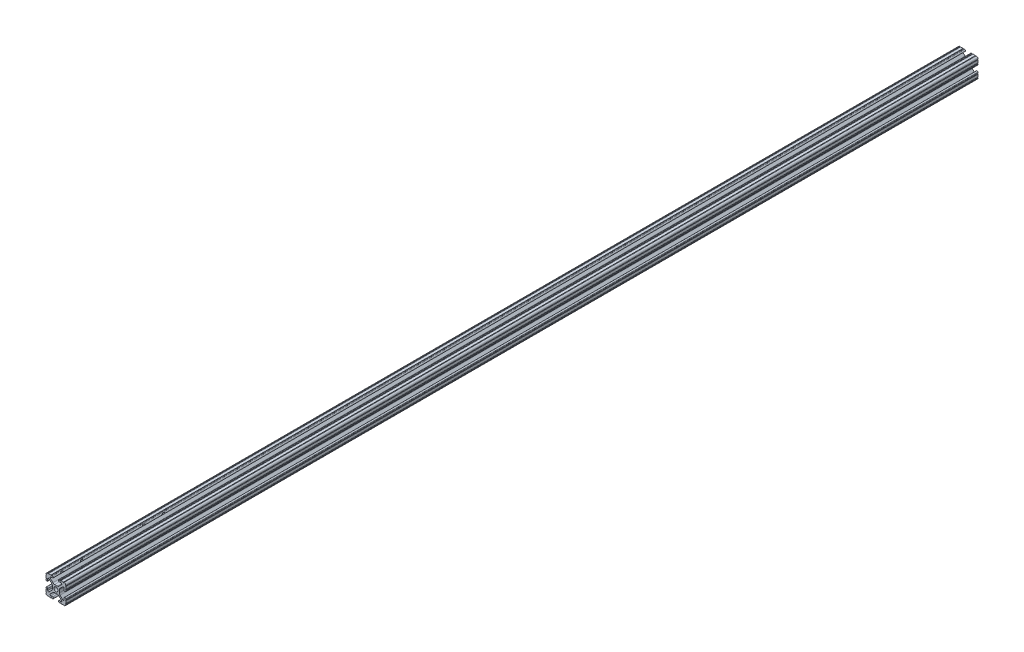
from build123d import *

# Parameters (mm, degrees)
SKETCH1_R                      = 2.6035
BOSS_EXTRUDE1_DEPTH            = 1168.4
CUT_EXTRUDE1_REACH             = 3634.263
SKETCH2_R                      = 3.7719
CUT_EXTRUDE1_DIRECTION_2_REACH = 3634.263


with BuildPart() as part:
    # Sketch1 → Boss-Extrude1 (new body)
    with BuildSketch(Plane(origin=(0, 0, -2463.8), x_dir=(-1, 0, 0), z_dir=(0, 0, -1))):
        with BuildLine():
            Line((12.7, -9.5504), (12.7, -6.3330836))
            ThreePointArc((12.7, -6.3330836), (12.192, -5.8250836), (12.7, -5.3170836))
            Line((12.7, -5.3170836), (12.7, -4.3434))
            ThreePointArc((12.7, -4.3434), (11.5951, -3.2385), (10.4902, -4.3434))
            Line((10.4902, -4.3434), (10.4902, -6.474794456))
            ThreePointArc((10.4902, -6.474794456), (9.863006367, -7.413456061), (8.75577951, -7.193214945))
            Line((8.75577951, -7.193214945), (5.42573597, -3.863171405))
            ThreePointArc((5.42573597, -3.863171405), (4.737482484, -2.833127272), (4.4958, -1.618107374))
            Line((4.4958, -1.618107374), (4.4958, 1.618107374))
            ThreePointArc((4.4958, 1.618107374), (4.737482484, 2.833127272), (5.42573597, 3.863171405))
            Line((5.42573597, 3.863171405), (8.75577951, 7.193214945))
            ThreePointArc((8.75577951, 7.193214945), (9.863006367, 7.413456061), (10.4902, 6.474794456))
            Line((10.4902, 6.474794456), (10.4902, 4.343399971))
            ThreePointArc((10.4902, 4.343399971), (11.5951, 3.238499971), (12.7, 4.343399971))
            Line((12.7, 4.343399971), (12.7, 5.3170836))
            ThreePointArc((12.7, 5.3170836), (12.192, 5.8250836), (12.7, 6.3330836))
            Line((12.7, 6.3330836), (12.7, 9.5504))
            ThreePointArc((12.7, 9.5504), (12.192000006, 10.058323491), (12.699846982, 10.566399977))
            ThreePointArc((12.699846982, 10.566399977), (12.082522516, 12.082522516), (10.566399977, 12.699846982))
            ThreePointArc((10.566399977, 12.699846982), (10.058323491, 12.192000006), (9.5504, 12.7))
            Line((9.5504, 12.7), (6.3330836, 12.7))
            ThreePointArc((6.3330836, 12.7), (5.8250836, 12.192), (5.3170836, 12.7))
            Line((5.3170836, 12.7), (4.3434, 12.7))
            ThreePointArc((4.3434, 12.7), (3.2385, 11.5951), (4.3434, 10.4902))
            Line((4.3434, 10.4902), (6.474794456, 10.4902))
            ThreePointArc((6.474794456, 10.4902), (7.413456061, 9.863006367), (7.193214945, 8.75577951))
            Line((7.193214945, 8.75577951), (3.863171405, 5.42573597))
            ThreePointArc((3.863171405, 5.42573597), (2.833127272, 4.737482484), (1.618107374, 4.4958))
            Line((1.618107374, 4.4958), (-1.618107374, 4.4958))
            ThreePointArc((-1.618107374, 4.4958), (-2.833127272, 4.737482484), (-3.863171405, 5.42573597))
            Line((-3.863171405, 5.42573597), (-7.193214945, 8.75577951))
            ThreePointArc((-7.193214945, 8.75577951), (-7.413456061, 9.863006367), (-6.474794456, 10.4902))
            Line((-6.474794456, 10.4902), (-4.343399971, 10.4902))
            ThreePointArc((-4.343399971, 10.4902), (-3.238499971, 11.5951), (-4.343399971, 12.7))
            Line((-4.343399971, 12.7), (-5.3170836, 12.7))
            ThreePointArc((-5.3170836, 12.7), (-5.8250836, 12.192), (-6.3330836, 12.7))
            Line((-6.3330836, 12.7), (-9.5504, 12.7))
            ThreePointArc((-9.5504, 12.7), (-10.058323491, 12.192000006), (-10.566399977, 12.699846982))
            ThreePointArc((-10.566399977, 12.699846982), (-12.082522516, 12.082522516), (-12.699846982, 10.566399977))
            ThreePointArc((-12.699846982, 10.566399977), (-12.192000006, 10.058323491), (-12.7, 9.5504))
            Line((-12.7, 9.5504), (-12.7, 6.3330836))
            ThreePointArc((-12.7, 6.3330836), (-12.192, 5.8250836), (-12.7, 5.3170836))
            Line((-12.7, 5.3170836), (-12.7, 4.3434))
            ThreePointArc((-12.7, 4.3434), (-11.5951, 3.2385), (-10.4902, 4.3434))
            Line((-10.4902, 4.3434), (-10.4902, 6.474794456))
            ThreePointArc((-10.4902, 6.474794456), (-9.863006367, 7.413456061), (-8.75577951, 7.193214945))
            Line((-8.75577951, 7.193214945), (-5.42573597, 3.863171405))
            ThreePointArc((-5.42573597, 3.863171405), (-4.737482484, 2.833127272), (-4.4958, 1.618107374))
            Line((-4.4958, 1.618107374), (-4.4958, -1.618107374))
            ThreePointArc((-4.4958, -1.618107374), (-4.737482484, -2.833127272), (-5.42573597, -3.863171405))
            Line((-5.42573597, -3.863171405), (-8.75577951, -7.193214945))
            ThreePointArc((-8.75577951, -7.193214945), (-9.863006367, -7.413456061), (-10.4902, -6.474794456))
            Line((-10.4902, -6.474794456), (-10.4902, -4.343399971))
            ThreePointArc((-10.4902, -4.343399971), (-11.5951, -3.238499971), (-12.7, -4.343399971))
            Line((-12.7, -4.343399971), (-12.7, -5.3170836))
            ThreePointArc((-12.7, -5.3170836), (-12.192, -5.8250836), (-12.7, -6.3330836))
            Line((-12.7, -6.3330836), (-12.7, -9.5504))
            ThreePointArc((-12.7, -9.5504), (-12.192000006, -10.058323491), (-12.699846982, -10.566399977))
            ThreePointArc((-12.699846982, -10.566399977), (-12.082522516, -12.082522516), (-10.566399977, -12.699846982))
            ThreePointArc((-10.566399977, -12.699846982), (-10.058323491, -12.192000006), (-9.5504, -12.7))
            Line((-9.5504, -12.7), (-6.3330836, -12.7))
            ThreePointArc((-6.3330836, -12.7), (-5.8250836, -12.192), (-5.3170836, -12.7))
            Line((-5.3170836, -12.7), (-4.3434, -12.7))
            ThreePointArc((-4.3434, -12.7), (-3.2385, -11.5951), (-4.3434, -10.4902))
            Line((-4.3434, -10.4902), (-6.474794456, -10.4902))
            ThreePointArc((-6.474794456, -10.4902), (-7.413456061, -9.863006367), (-7.193214945, -8.75577951))
            Line((-7.193214945, -8.75577951), (-3.863171405, -5.42573597))
            ThreePointArc((-3.863171405, -5.42573597), (-2.833127272, -4.737482484), (-1.618107374, -4.4958))
            Line((-1.618107374, -4.4958), (1.618107374, -4.4958))
            ThreePointArc((1.618107374, -4.4958), (2.833127272, -4.737482484), (3.863171405, -5.42573597))
            Line((3.863171405, -5.42573597), (7.193214945, -8.75577951))
            ThreePointArc((7.193214945, -8.75577951), (7.413456061, -9.863006367), (6.474794456, -10.4902))
            Line((6.474794456, -10.4902), (4.343399971, -10.4902))
            ThreePointArc((4.343399971, -10.4902), (3.238499971, -11.5951), (4.343399971, -12.7))
            Line((4.343399971, -12.7), (5.3170836, -12.7))
            ThreePointArc((5.3170836, -12.7), (5.8250836, -12.192), (6.3330836, -12.7))
            Line((6.3330836, -12.7), (9.5504, -12.7))
            ThreePointArc((9.5504, -12.7), (10.058323491, -12.192000006), (10.566399977, -12.699846982))
            ThreePointArc((10.566399977, -12.699846982), (12.082522516, -12.082522516), (12.699846982, -10.566399977))
            ThreePointArc((12.699846982, -10.566399977), (12.192000006, -10.058323491), (12.7, -9.5504))
        make_face()
        Circle(SKETCH1_R, mode=Mode.SUBTRACT)
    extrude(amount=BOSS_EXTRUDE1_DEPTH)

    # Cut-Extrude1: up to this face of the body (flat: up to its plane)
    cut_extrude1_end = Plane(part.part.faces().sort_by_distance((-7.9417418, -12.7, -3048))[0])
    # Sketch2 → Cut-Extrude1 (cut, up to the picked face)
    with BuildSketch(Plane(origin=(0, 4.4958, 0), x_dir=(1, 0, 0), z_dir=(0, 1, 0)), mode=Mode.PRIVATE) as cut_extrude1_sk1:
        with Locations((0, 2500.3125)):
            Circle(SKETCH2_R)
    cut_extrude1_tool1 = split(extrude(cut_extrude1_sk1.sketch, amount=-CUT_EXTRUDE1_REACH, mode=Mode.PRIVATE), bisect_by=cut_extrude1_end, keep=Keep.BOTH, mode=Mode.PRIVATE)
    # Sketch2 → Cut-Extrude1 (cut, up to the picked face)
    with BuildSketch(Plane(origin=(0, 4.4958, 0), x_dir=(1, 0, 0), z_dir=(0, 1, 0)), mode=Mode.PRIVATE) as cut_extrude1_sk2:
        with Locations((0, 2474.9125)):
            Circle(SKETCH2_R)
    cut_extrude1_tool2 = split(extrude(cut_extrude1_sk2.sketch, amount=-CUT_EXTRUDE1_REACH, mode=Mode.PRIVATE), bisect_by=cut_extrude1_end, keep=Keep.BOTH, mode=Mode.PRIVATE)
    # Sketch2 → Cut-Extrude1 (cut, up to the picked face)
    with BuildSketch(Plane(origin=(0, 4.4958, 0), x_dir=(1, 0, 0), z_dir=(0, 1, 0)), mode=Mode.PRIVATE) as cut_extrude1_sk3:
        with Locations((0, 2605.0875)):
            Circle(SKETCH2_R)
    cut_extrude1_tool3 = split(extrude(cut_extrude1_sk3.sketch, amount=-CUT_EXTRUDE1_REACH, mode=Mode.PRIVATE), bisect_by=cut_extrude1_end, keep=Keep.BOTH, mode=Mode.PRIVATE)
    # Sketch2 → Cut-Extrude1 (cut, up to the picked face)
    with BuildSketch(Plane(origin=(0, 4.4958, 0), x_dir=(1, 0, 0), z_dir=(0, 1, 0)), mode=Mode.PRIVATE) as cut_extrude1_sk4:
        with Locations((0, 2579.6875)):
            Circle(SKETCH2_R)
    cut_extrude1_tool4 = split(extrude(cut_extrude1_sk4.sketch, amount=-CUT_EXTRUDE1_REACH, mode=Mode.PRIVATE), bisect_by=cut_extrude1_end, keep=Keep.BOTH, mode=Mode.PRIVATE)
    add(cut_extrude1_tool1.solids().sort_by(Axis((0, 4.4958, -2500.3125), (0, -1, 0)))[0], mode=Mode.SUBTRACT)
    add(cut_extrude1_tool2.solids().sort_by(Axis((0, 4.4958, -2474.9125), (0, -1, 0)))[0], mode=Mode.SUBTRACT)
    add(cut_extrude1_tool3.solids().sort_by(Axis((0, 4.4958, -2605.0875), (0, -1, 0)))[0], mode=Mode.SUBTRACT)
    add(cut_extrude1_tool4.solids().sort_by(Axis((0, 4.4958, -2579.6875), (0, -1, 0)))[0], mode=Mode.SUBTRACT)

    # Cut-Extrude1 direction 2: up to this face of the body (flat: up to its plane)
    cut_extrude1_direction_2_end = Plane(part.part.faces().sort_by_distance((-7.9417418, 12.7, -3048))[0])
    # Sketch2 → Cut-Extrude1 direction 2 (cut, up to the picked face)
    with BuildSketch(Plane(origin=(0, 4.4958, 0), x_dir=(1, 0, 0), z_dir=(0, 1, 0)), mode=Mode.PRIVATE) as cut_extrude1_direction_2_sk1:
        with Locations((0, 2500.3125)):
            Circle(SKETCH2_R)
    cut_extrude1_direction_2_tool1 = split(extrude(cut_extrude1_direction_2_sk1.sketch, amount=CUT_EXTRUDE1_DIRECTION_2_REACH, mode=Mode.PRIVATE), bisect_by=cut_extrude1_direction_2_end, keep=Keep.BOTH, mode=Mode.PRIVATE)
    # Sketch2 → Cut-Extrude1 direction 2 (cut, up to the picked face)
    with BuildSketch(Plane(origin=(0, 4.4958, 0), x_dir=(1, 0, 0), z_dir=(0, 1, 0)), mode=Mode.PRIVATE) as cut_extrude1_direction_2_sk2:
        with Locations((0, 2474.9125)):
            Circle(SKETCH2_R)
    cut_extrude1_direction_2_tool2 = split(extrude(cut_extrude1_direction_2_sk2.sketch, amount=CUT_EXTRUDE1_DIRECTION_2_REACH, mode=Mode.PRIVATE), bisect_by=cut_extrude1_direction_2_end, keep=Keep.BOTH, mode=Mode.PRIVATE)
    # Sketch2 → Cut-Extrude1 direction 2 (cut, up to the picked face)
    with BuildSketch(Plane(origin=(0, 4.4958, 0), x_dir=(1, 0, 0), z_dir=(0, 1, 0)), mode=Mode.PRIVATE) as cut_extrude1_direction_2_sk3:
        with Locations((0, 2605.0875)):
            Circle(SKETCH2_R)
    cut_extrude1_direction_2_tool3 = split(extrude(cut_extrude1_direction_2_sk3.sketch, amount=CUT_EXTRUDE1_DIRECTION_2_REACH, mode=Mode.PRIVATE), bisect_by=cut_extrude1_direction_2_end, keep=Keep.BOTH, mode=Mode.PRIVATE)
    # Sketch2 → Cut-Extrude1 direction 2 (cut, up to the picked face)
    with BuildSketch(Plane(origin=(0, 4.4958, 0), x_dir=(1, 0, 0), z_dir=(0, 1, 0)), mode=Mode.PRIVATE) as cut_extrude1_direction_2_sk4:
        with Locations((0, 2579.6875)):
            Circle(SKETCH2_R)
    cut_extrude1_direction_2_tool4 = split(extrude(cut_extrude1_direction_2_sk4.sketch, amount=CUT_EXTRUDE1_DIRECTION_2_REACH, mode=Mode.PRIVATE), bisect_by=cut_extrude1_direction_2_end, keep=Keep.BOTH, mode=Mode.PRIVATE)
    add(cut_extrude1_direction_2_tool1.solids().sort_by(Axis((0, 4.4958, -2500.3125), (0, 1, 0)))[0], mode=Mode.SUBTRACT)
    add(cut_extrude1_direction_2_tool2.solids().sort_by(Axis((0, 4.4958, -2474.9125), (0, 1, 0)))[0], mode=Mode.SUBTRACT)
    add(cut_extrude1_direction_2_tool3.solids().sort_by(Axis((0, 4.4958, -2605.0875), (0, 1, 0)))[0], mode=Mode.SUBTRACT)
    add(cut_extrude1_direction_2_tool4.solids().sort_by(Axis((0, 4.4958, -2579.6875), (0, 1, 0)))[0], mode=Mode.SUBTRACT)


solid = part.part
